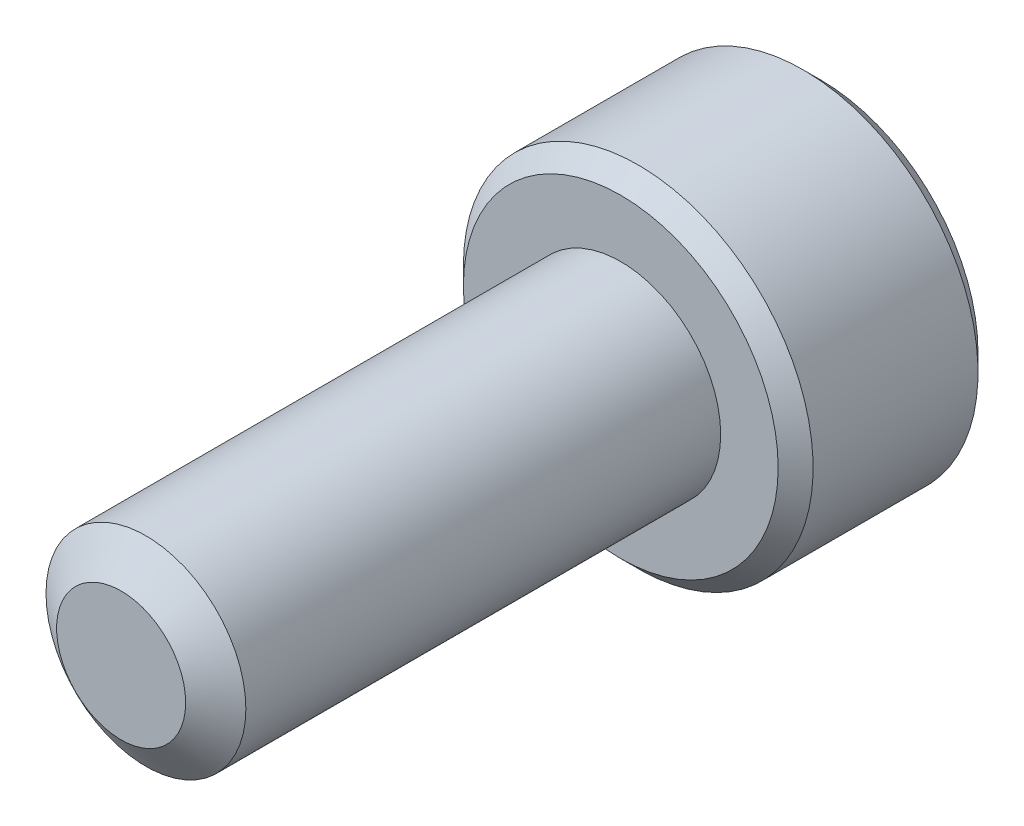
from build123d import *

# Parameters (mm, degrees)
SKETCH1_R          = 2
EXTRUDE1_DEPTH     = 10
SKETCH6_R          = 3.5
EXTRUDE2_DEPTH     = 4
CUT_EXTRUDE1_DEPTH = 2.25
CHAMFER1_SIZE      = 0.35


with BuildPart() as part:
    # Sketch1 → Extrude1 (new body)
    with BuildSketch(Plane.XY):
        Circle(SKETCH1_R)
    extrude(amount=-EXTRUDE1_DEPTH)

    # Sketch4 → Cut-Revolve1 (revolve, cut)
    with BuildSketch(Plane(origin=(0, 0, 0), x_dir=(0, 0, -1), z_dir=(1, 0, 0))):
        Polygon((0.496211411, 2), (0, 1.291336663), (0, 2), align=None)
    revolve(axis=Axis((0, 0, 0), (0, 0, -1)), mode=Mode.SUBTRACT)

    # Sketch6 → Extrude2 (add)
    with BuildSketch(Plane(origin=(0, 0, -10), x_dir=(-1, 0, 0), z_dir=(0, 0, -1))):
        Circle(SKETCH6_R)
    extrude(amount=EXTRUDE2_DEPTH)

    # Sketch7 → Cut-Extrude1 (cut)
    with BuildSketch(Plane(origin=(0, 0, -14), x_dir=(-1, 0, 0), z_dir=(0, 0, -1))):
        Polygon((0, 1.732050808), (-1.5, 0.866025404), (-1.5, -0.866025404), (0, -1.732050808), (1.5, -0.866025404), (1.5, 0.866025404), align=None)
    extrude(amount=-CUT_EXTRUDE1_DEPTH, mode=Mode.SUBTRACT)

    # Cut-Extrude2 cone 1 section (through the dimple's axis) → Cut-Extrude2 (revolve, cut)
    with BuildSketch(Plane(origin=(0, 0, -14), x_dir=(0, 1, 0), z_dir=(1, 0, 0))):
        Polygon((0, 0), (1.732050808, 0), (0, 1.732050808), align=None)
    revolve(axis=Axis((0, 0, -14), (0, 0, 1)), mode=Mode.SUBTRACT)

    # Chamfer1
    chamfer1_edges = [part.edges().sort_by_distance(p)[0] for p in [
        (3.5, 0, -14),
        (3.5, 0, -10),
    ]]
    chamfer(chamfer1_edges, length=CHAMFER1_SIZE)


solid = part.part
